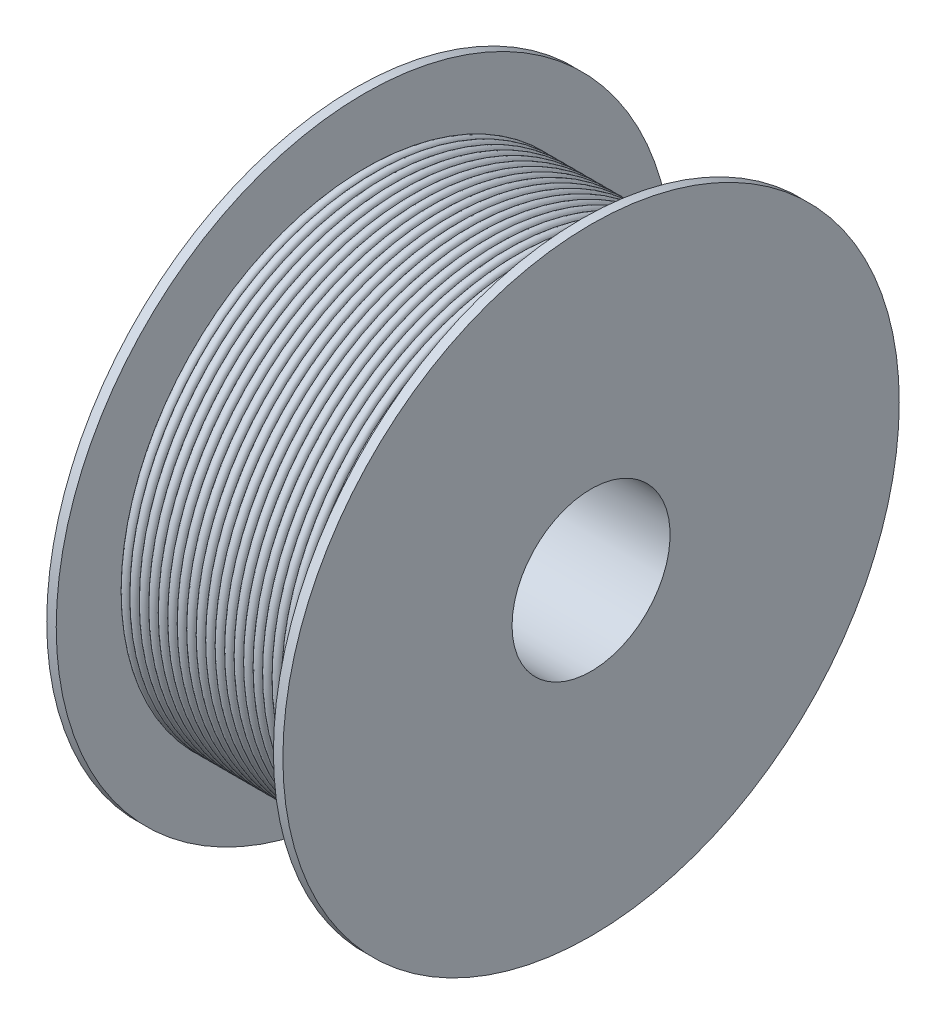
from build123d import *


with BuildPart() as part:
    # Sketch1 → Revolve1 (revolve)
    with BuildSketch(Plane(origin=(0, 0, 0), x_dir=(1, 0, 0), z_dir=(0, 1, 0))):
        with BuildLine():
            Line((0, 58.783038795), (0, 131.283038795))
            Line((0, 131.283038795), (3, 131.283038795))
            Line((3, 131.283038795), (3, 110.189064257))
            ThreePointArc((3, 110.189064257), (4.372298868, 111.561363125), (5.744597737, 110.189064257))
            ThreePointArc((5.744597737, 110.189064257), (7.116896605, 111.561363125), (8.489195473, 110.189064257))
            Line((8.489195473, 110.189064257), (8.744597737, 110.189064257))
            ThreePointArc((8.744597737, 110.189064257), (10.116896605, 111.561363125), (11.489195473, 110.189064257))
            Line((11.489195473, 110.189064257), (11.744597737, 110.189064257))
            ThreePointArc((11.744597737, 110.189064257), (13.116896605, 111.561363125), (14.489195473, 110.189064257))
            Line((14.489195473, 110.189064257), (14.744597737, 110.189064257))
            ThreePointArc((14.744597737, 110.189064257), (16.116896605, 111.561363125), (17.489195473, 110.189064257))
            Line((17.489195473, 110.189064257), (17.744597737, 110.189064257))
            ThreePointArc((17.744597737, 110.189064257), (19.116896605, 111.561363125), (20.489195473, 110.189064257))
            Line((20.489195473, 110.189064257), (20.744597737, 110.189064257))
            ThreePointArc((20.744597737, 110.189064257), (22.116896605, 111.561363125), (23.489195473, 110.189064257))
            Line((23.489195473, 110.189064257), (23.744597737, 110.189064257))
            ThreePointArc((23.744597737, 110.189064257), (25.116896605, 111.561363125), (26.489195473, 110.189064257))
            Line((26.489195473, 110.189064257), (26.744597737, 110.189064257))
            ThreePointArc((26.744597737, 110.189064257), (28.116896605, 111.561363125), (29.489195473, 110.189064257))
            Line((29.489195473, 110.189064257), (29.744597737, 110.189064257))
            ThreePointArc((29.744597737, 110.189064257), (31.116896605, 111.561363125), (32.489195473, 110.189064257))
            Line((32.489195473, 110.189064257), (32.744597737, 110.189064257))
            ThreePointArc((32.744597737, 110.189064257), (34.116896605, 111.561363125), (35.489195473, 110.189064257))
            Line((35.489195473, 110.189064257), (35.744597737, 110.189064257))
            ThreePointArc((35.744597737, 110.189064257), (37.116896605, 111.561363125), (38.489195473, 110.189064257))
            Line((38.489195473, 110.189064257), (38.744597737, 110.189064257))
            ThreePointArc((38.744597737, 110.189064257), (40.116896605, 111.561363125), (41.489195473, 110.189064257))
            Line((41.489195473, 110.189064257), (41.744597737, 110.189064257))
            ThreePointArc((41.744597737, 110.189064257), (43.116896605, 111.561363125), (44.489195473, 110.189064257))
            Line((44.489195473, 110.189064257), (44.744597737, 110.189064257))
            ThreePointArc((44.744597737, 110.189064257), (46.116896605, 111.561363125), (47.489195473, 110.189064257))
            Line((47.489195473, 110.189064257), (47.744597737, 110.189064257))
            ThreePointArc((47.744597737, 110.189064257), (49.116896605, 111.561363125), (50.489195473, 110.189064257))
            Line((50.489195473, 110.189064257), (50.744597737, 110.189064257))
            ThreePointArc((50.744597737, 110.189064257), (52.116896605, 111.561363125), (53.489195473, 110.189064257))
            Line((53.489195473, 110.189064257), (53.744597737, 110.189064257))
            ThreePointArc((53.744597737, 110.189064257), (55.116896605, 111.561363125), (56.489195473, 110.189064257))
            Line((56.489195473, 110.189064257), (56.744597737, 110.189064257))
            ThreePointArc((56.744597737, 110.189064257), (58.116896605, 111.561363125), (59.489195473, 110.189064257))
            Line((59.489195473, 110.189064257), (59.744597737, 110.189064257))
            ThreePointArc((59.744597737, 110.189064257), (61.116896605, 111.561363125), (62.489195473, 110.189064257))
            Line((62.489195473, 110.189064257), (62.744597737, 110.189064257))
            ThreePointArc((62.744597737, 110.189064257), (64.116896605, 111.561363125), (65.489195473, 110.189064257))
            Line((65.489195473, 110.189064257), (65.744597737, 110.189064257))
            ThreePointArc((65.744597737, 110.189064257), (67.116896605, 111.561363125), (68.489195473, 110.189064257))
            Line((68.489195473, 110.189064257), (68.744597737, 110.189064257))
            ThreePointArc((68.744597737, 110.189064257), (70.116896605, 111.561363125), (71.489195473, 110.189064257))
            Line((71.489195473, 110.189064257), (71.707548459, 110.189064257))
            Line((71.707548459, 110.189064257), (71.707548459, 131.283038795))
            Line((71.707548459, 131.283038795), (74.707548459, 131.283038795))
            Line((74.707548459, 131.283038795), (74.707548459, 58.783038795))
            Line((74.707548459, 58.783038795), (0, 58.783038795))
        make_face()
    revolve(axis=Axis((-2.327356302, 0, -33.783038795), (1, 0, 0)))


solid = part.part
